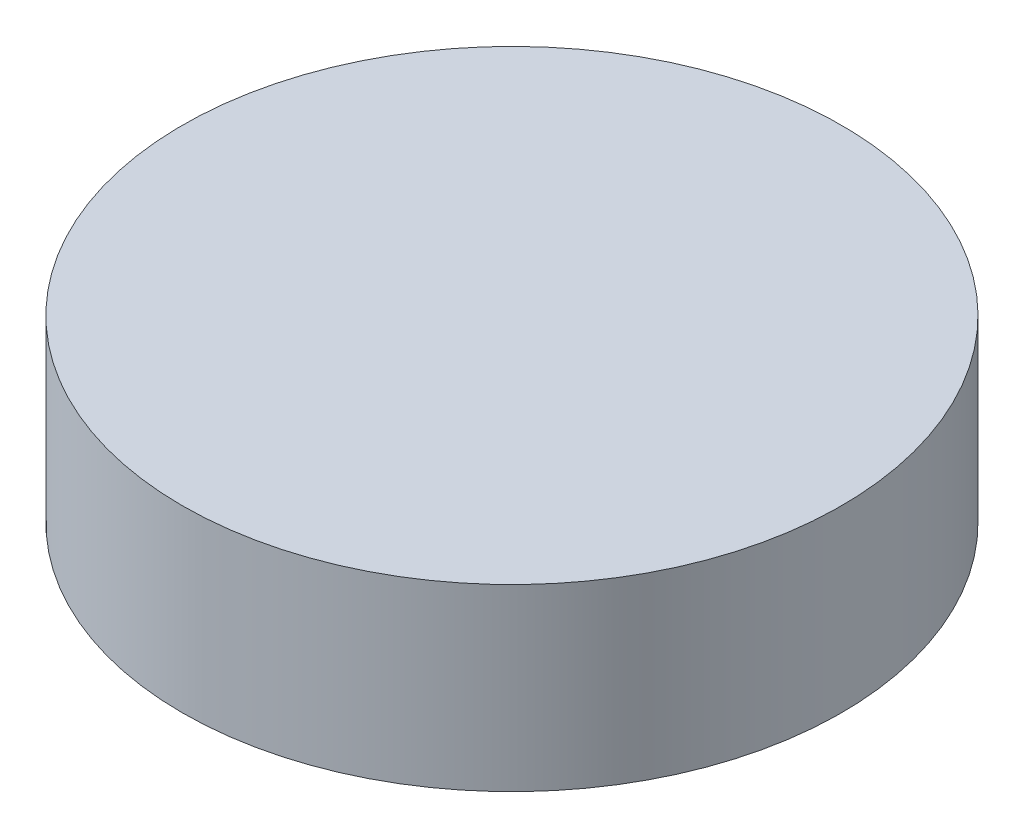
from build123d import *

# Parameters (mm, degrees)
SKETCH1_R           = 18.375
BOSS_EXTRUDE1_DEPTH = 10


with BuildPart() as part:
    # Sketch1 → Boss-Extrude1 (new body)
    with BuildSketch(Plane(origin=(0, 0, 0), x_dir=(1, 0, 0), z_dir=(0, 1, 0))):
        Circle(SKETCH1_R)
    extrude(amount=BOSS_EXTRUDE1_DEPTH)


solid = part.part
